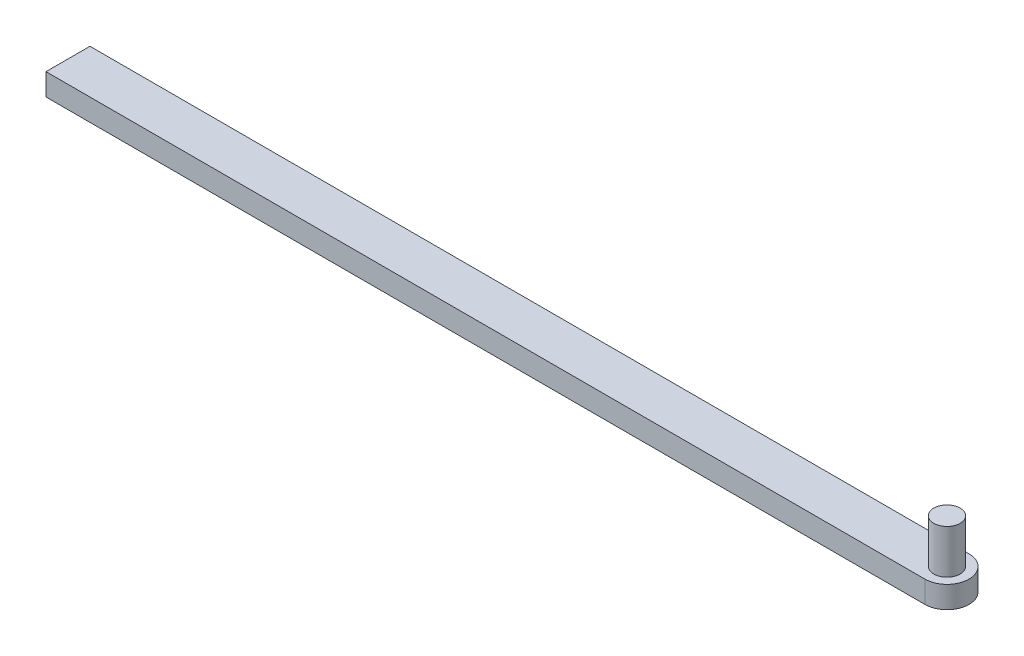
from build123d import *

# Parameters (mm, degrees)
EXTRUDE_1_DEPTH = 5
SKETCH_2_R      = 3
EXTRUDE_2_DEPTH = 10


with BuildPart() as part:
    # 草图1 → 凸台-拉伸1 (new body)
    with BuildSketch(Plane(origin=(0, 0, 0), x_dir=(1, 0, 0), z_dir=(0, 1, 0))):
        with BuildLine():
            Line((0, 0), (200, 0))
            ThreePointArc((200, 0), (205, -5), (200, -10))
            Line((200, -10), (0, -10))
            Line((0, -10), (0, 0))
        make_face()
    extrude(amount=EXTRUDE_1_DEPTH)

    # 草图2 → 凸台-拉伸2 (add)
    with BuildSketch(Plane(origin=(0, 5, 0), x_dir=(1, 0, 0), z_dir=(0, 1, 0))):
        with Locations((200, -5)):
            Circle(SKETCH_2_R)
    extrude(amount=EXTRUDE_2_DEPTH)


solid = part.part
